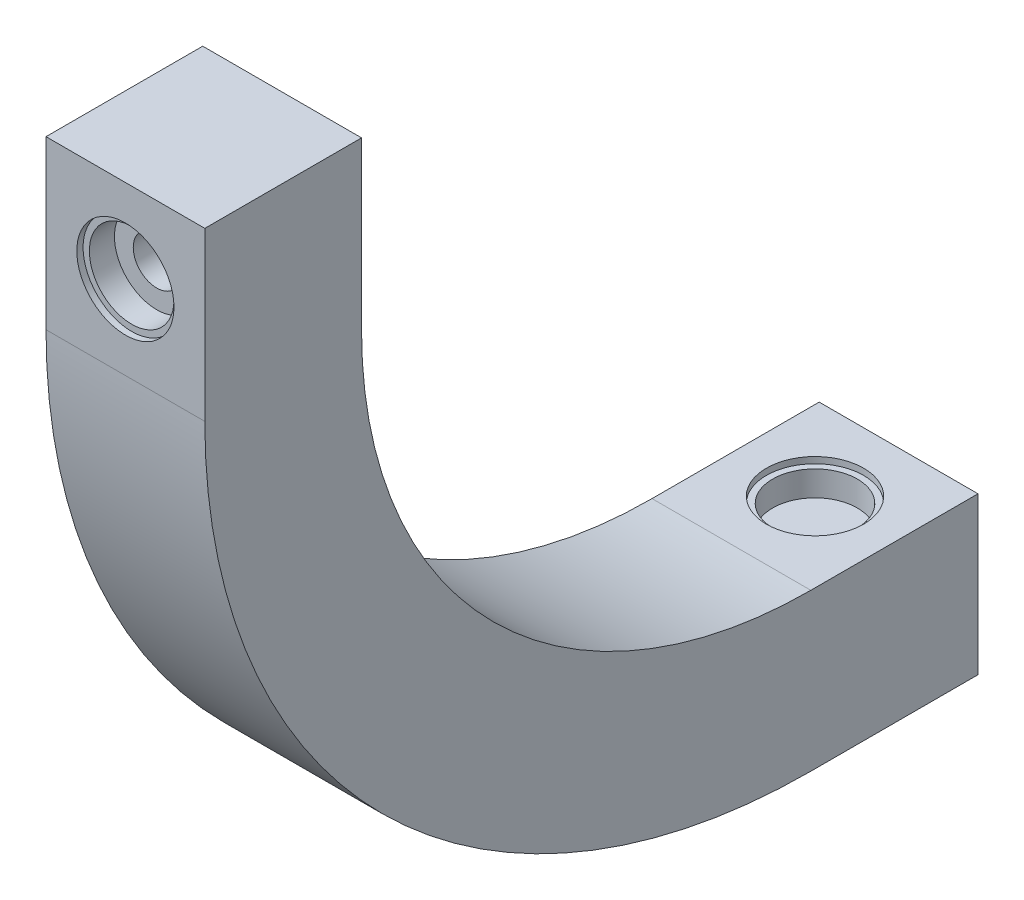
from build123d import *

# Parameters (mm, degrees)
BOSS_EXTRUDE1_DEPTH      = 7.6
BOSS_EXTRUDE1_DEPTH_BACK = 7.6
SKETCH7_R                = 2.25
CUT_EXTRUDE1_DEPTH       = 94.646996748
SKETCH15_R               = 1.5
CUT_EXTRUDE11_DEPTH      = 6
CIRPATTERN1_COUNT        = 2
CIRPATTERN1_ANGLE        = 90


with BuildPart() as part:
    # Sketch5 → Boss-Extrude1 (new, two sides: drawn at the far end of the back side and taken through both)
    with BuildSketch(Plane(origin=(0, 0, 0), x_dir=(0, 0, -1), z_dir=(1, 0, 0)).offset(-BOSS_EXTRUDE1_DEPTH_BACK)):
        with BuildLine():
            Line((-51, 8), (-51, 0))
            Line((-51, 0), (-51, -8))
            ThreePointArc((-51, -8), (-38.405591591, -38.405591591), (-8, -51))
            Line((-8, -51), (0, -51))
            Line((0, -51), (8, -51))
            Line((8, -51), (8, -66))
            Line((8, -66), (-8, -66))
            ThreePointArc((-8, -66), (-49.012193309, -49.012193309), (-66, -8))
            Line((-66, -8), (-66, 8))
            Line((-66, 8), (-51, 8))
        make_face()
    extrude(amount=BOSS_EXTRUDE1_DEPTH + BOSS_EXTRUDE1_DEPTH_BACK)

    # Sketch7 → Cut-Extrude1 (cut, through all)
    with BuildSketch(Plane.XY):
        Circle(SKETCH7_R)
    extrude(amount=CUT_EXTRUDE1_DEPTH, mode=Mode.SUBTRACT)

    # Sketch15 → Cut-Extrude11 (cut)
    with BuildSketch(Plane.XZ.offset(66)):
        Circle(SKETCH15_R)
    extrude(amount=-CUT_EXTRUDE11_DEPTH, mode=Mode.SUBTRACT)

    # Sketch18 → Cut-Revolve1 (revolve, cut)
    with BuildSketch(Plane(origin=(0, 0, 0), x_dir=(0, 0, -1), z_dir=(1, 0, 0))):
        Polygon((-66, 4.65), (-66, 0), (-63, 0), (-63, 4.05), (-65.4, 4.05), (-65.4, 4.65), align=None)
        Polygon((-51.6, 4.65), (-51, 4.65), (-51, 0), (-54, 0), (-54, 4.05), (-51.6, 4.05), align=None)
    cut_revolve1 = revolve(axis=Axis((0, 0, 109.558527697), (0, 0, -1)), mode=Mode.SUBTRACT)

    # CirPattern1: Cut-Revolve1 ×2 about axis
    cirpattern1_axis = Axis((8.36, 0, 0), (1, 0, 0))
    for i in range(1, CIRPATTERN1_COUNT):
        add(cut_revolve1.rotate(cirpattern1_axis, i * CIRPATTERN1_ANGLE / (CIRPATTERN1_COUNT - 1)), mode=Mode.SUBTRACT)


solid = part.part
